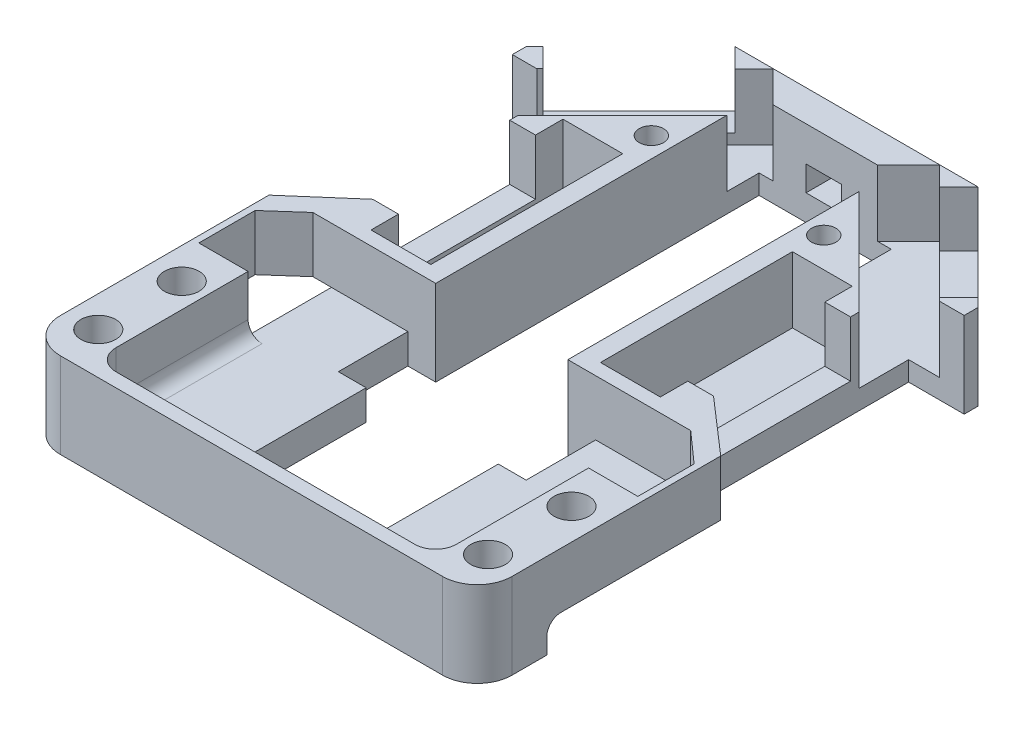
from build123d import *

# Parameters (mm, degrees)
SKETCH1_W               = 70
SKETCH1_H               = 85
BOSS_EXTRUDE1_DEPTH     = 2.8
SKETCH2_W               = 10.5
SKETCH2_H               = 60
CUT_EXTRUDE1_DEPTH      = 10
SKETCH3_W               = 2.519429159
SKETCH3_H               = 8
CUT_EXTRUDE2_DEPTH      = 10
CUT_EXTRUDE3_DEPTH      = 10
BOSS_EXTRUDE2_OUTLINE_W = 8.6
BOSS_EXTRUDE2_OUTLINE_H = 27.6
BOSS_EXTRUDE2_DEPTH     = 1.5
BOSS_EXTRUDE3_DEPTH     = 8
BOSS_EXTRUDE4_DEPTH     = 8
CUT_EXTRUDE5_DEPTH      = 8
SKETCH14_W              = 64.961141682
SKETCH14_H              = 2
BOSS_EXTRUDE5_DEPTH     = 12.3
FILLET1_R               = 5
SKETCH15_W              = 4
SKETCH15_H              = 10
CUT_EXTRUDE8_DEPTH      = 12.7
SKETCH16_R              = 1.75
CUT_EXTRUDE9_DEPTH      = 12.7
FILLET3_R               = 2
FILLET4_R               = 2
FILLET5_R               = 3
FILLET6_R               = 2
SKETCH17_R              = 2.5
CUT_EXTRUDE10_DEPTH     = 8
SKETCH18_W              = 19
SKETCH18_H              = 7
CUT_EXTRUDE11_DEPTH     = 57.451881976
SKETCH19_W              = 5.1
SKETCH19_H              = 3.6
CUT_EXTRUDE12_DEPTH     = 10


# Read off the part's stored shape, not the designer's step: Boss-Extrude2
with BuildPart() as part:
    # Sketch1 → Boss-Extrude1 (new body)
    with BuildSketch(Plane(origin=(0, 0, 0), x_dir=(1, 0, 0), z_dir=(0, 1, 0))):
        Rectangle(SKETCH1_W, SKETCH1_H)
    extrude(amount=BOSS_EXTRUDE1_DEPTH)

    # Sketch2 → Cut-Extrude1 (cut)
    with BuildSketch(Plane(origin=(0, 0, 0), x_dir=(-1, 0, 0), z_dir=(0, -1, 0))):
        with Locations((-29.75, -4.5)):
            Rectangle(SKETCH2_W, SKETCH2_H)
        with Locations((29.75, -4.5)):
            Rectangle(SKETCH2_W, SKETCH2_H)
    extrude(amount=-CUT_EXTRUDE1_DEPTH, mode=Mode.SUBTRACT)

    # Sketch3 → Cut-Extrude2 (cut)
    with BuildSketch(Plane(origin=(0, 2.8, 0), x_dir=(1, 0, 0), z_dir=(0, 1, 0))):
        Polygon((17.462549034, 42.5), (35, 42.5), (35, 25.5), (32.484854108, 25.5), (32.484996169, 27.489999862), align=None)
        with Locations((33.740285421, -38.5)):
            Rectangle(SKETCH3_W, SKETCH3_H)
        with Locations((-33.740285421, -38.5)):
            Rectangle(SKETCH3_W, SKETCH3_H)
        Polygon((-32.484996169, 27.489999862), (-17.462549034, 42.5), (-35, 42.5), (-35, 25.5), (-32.484854108, 25.5), align=None)
    extrude(amount=-CUT_EXTRUDE2_DEPTH, mode=Mode.SUBTRACT)

    # Sketch5 → Cut-Extrude3 (cut)
    with BuildSketch(Plane(origin=(0, 2.8, 0), x_dir=(1, 0, 0), z_dir=(0, 1, 0))):
        Polygon((-9.5, -42.5), (9.5, -42.5), (9.5, 31), (5.25, 31), (5.25, 38), (-5.25, 38), (-5.25, 31), (-9.5, 31), align=None)
    extrude(amount=-CUT_EXTRUDE3_DEPTH, mode=Mode.SUBTRACT)

    # Boss-Extrude2 outline → Boss-Extrude2 (add)
    with BuildSketch(Plane(origin=(0, 2.8, 0), x_dir=(1, 0, 0), z_dir=(0, 1, 0))):
        Polygon((-32.480570841, -42.5), (-9.5, -42.5), (-9.5, 31), (-5.25, 31), (-5.25, 38), (5.25, 38), (5.25, 31), (9.5, 31), (9.5, -42.5), (32.480570841, -42.5), (32.480570841, -34.5), (24.5, -34.5), (24.5, 18.363483562), (6.1866146, 36.661695224), (11.982486603, 42.462373437), (28.958926038, 25.5), (32.484854108, 25.5), (32.484996169, 27.489999862), (17.462549034, 42.5), (-17.462549034, 42.5), (-32.484996169, 27.489999862), (-32.484854108, 25.5), (-28.958926038, 25.5), (-11.982486603, 42.462373437), (-6.1866146, 36.661695224), (-24.5, 18.363483562), (-24.5, -34.5), (-32.480570841, -34.5), align=None)
        with Locations((-16.5, 7.293849796)):
            Rectangle(BOSS_EXTRUDE2_OUTLINE_W, BOSS_EXTRUDE2_OUTLINE_H, mode=Mode.SUBTRACT)
        with Locations((16.5, 7.293849796)):
            Rectangle(BOSS_EXTRUDE2_OUTLINE_W, BOSS_EXTRUDE2_OUTLINE_H, mode=Mode.SUBTRACT)
    extrude(amount=BOSS_EXTRUDE2_DEPTH)

    # Sketch9 → Boss-Extrude3 (add)
    with BuildSketch(Plane(origin=(0, 4.3, 0), x_dir=(1, 0, 0), z_dir=(0, 1, 0))):
        Polygon((-24.5, -34.5), (-32.480570841, -34.5), (-32.480570841, -42.5), (-9.5, -42.5), (-9.5, 31), (-5.25, 31), (-5.25, 38), (0, 38), (5.25, 38), (5.25, 31), (9.5, 31), (9.5, -42.5), (32.480570841, -42.5), (32.480570841, -34.5), (24.5, -34.5), (24.5, -2.556150204), (20.8, -2.556150204), (20.8, -6.506150204), (12.2, -6.506150204), (12.2, 21.093849796), (20.8, 21.093849796), (20.8, 17.143849796), (24.5, 17.143849796), (24.5, 18.363483562), (6.1866146, 36.661695224), (11.982486603, 42.462373437), (14.705975764, 39.74114085), (17.462549034, 42.5), (-17.462549034, 42.5), (-14.705975764, 39.74114085), (-11.982486603, 42.462373437), (-6.1866146, 36.661695224), (-24.5, 18.363483562), (-24.5, 17.143849796), (-20.8, 17.143849796), (-20.8, 21.093849796), (-12.2, 21.093849796), (-12.2, -6.506150204), (-20.8, -6.506150204), (-20.8, -2.556150204), (-24.5, -2.556150204), align=None)
        Polygon((-31.256844783, 28.717133652), (-32.484996169, 27.489999862), (-32.484854108, 25.5), (-28.958926038, 25.5), (-28.500271514, 25.958274502), align=None)
        Polygon((32.484996169, 27.489999862), (31.256844783, 28.717133652), (28.500271514, 25.958274502), (28.958926038, 25.5), (32.484854108, 25.5), align=None)
    extrude(amount=BOSS_EXTRUDE3_DEPTH)

    # Sketch10 → Boss-Extrude4 (add)
    with BuildSketch(Plane(origin=(0, 12.3, 0), x_dir=(1, 0, 0), z_dir=(0, 1, 0))):
        Polygon((-32.480570841, -34.5), (-24.5, -34.5), (-24.5, -2.556150204), (-32.480570841, -9.5), align=None)
        Polygon((32.480570841, -34.5), (24.5, -34.5), (24.5, -9.5), (24.5, -2.556150204), (32.480570841, -9.5), align=None)
    extrude(amount=-BOSS_EXTRUDE4_DEPTH)

    # Sketch11 → Cut-Extrude5 (cut)
    with BuildSketch(Plane(origin=(0, 12.3, 0), x_dir=(1, 0, 0), z_dir=(0, 1, 0))):
        Polygon((-24.480570841, -42.5), (-24.480570841, -20.499611406), (-31.560570841, -20.499611406), (-31.560570841, -12.405434935), (-27.162134436, -8.5), (-9.5, -8.5), (-9.5, -12.405776235), (-9.5, -42.5), align=None)
        Polygon((9.5, -42.5), (24.480570841, -42.5), (24.480570841, -20.499611406), (31.560570841, -20.499611406), (31.560570841, -12.405434935), (27.162134436, -8.5), (9.5, -8.5), (9.5, -12.405776235), align=None)
    extrude(amount=-CUT_EXTRUDE5_DEPTH, mode=Mode.SUBTRACT)

    # Sketch14 → Boss-Extrude5 (add)
    with BuildSketch(Plane(origin=(0, 0, 0), x_dir=(-1, 0, 0), z_dir=(0, -1, 0))):
        with Locations((0, -43.5)):
            Rectangle(SKETCH14_W, SKETCH14_H)
    extrude(amount=-BOSS_EXTRUDE5_DEPTH)

    # Fillet1
    fillet1_edges = [part.edges().sort_by_distance(p)[0] for p in [
        (32.480570841, 6.15, 44.5),
        (-32.480570841, 6.15, 44.5),
    ]]
    fillet(fillet1_edges, radius=FILLET1_R)

    # Sketch15 → Cut-Extrude8 (cut)
    with BuildSketch(Plane(origin=(0, 4.3, 0), x_dir=(1, 0, 0), z_dir=(0, 1, 0))):
        with Locations((-11.5, -13.5)):
            Rectangle(SKETCH15_W, SKETCH15_H)
        with Locations((11.5, -13.5)):
            Rectangle(SKETCH15_W, SKETCH15_H)
    extrude(amount=-CUT_EXTRUDE8_DEPTH, mode=Mode.SUBTRACT)

    # Sketch16 → Cut-Extrude9 (cut)
    with BuildSketch(Plane(origin=(0, 0, 0), x_dir=(-1, 0, 0), z_dir=(0, -1, 0))):
        with Locations(Location((-17.000570841, -39, 0), (0, 0, 90))):
            Circle(SKETCH16_R)
        with Locations(Location((-12.394846918, 25.4, 0), (0, 0, 90))):
            Circle(SKETCH16_R)
        with Locations(Location((12.394846918, 25.4, 0), (0, 0, 270))):
            Circle(SKETCH16_R)
        with Locations(Location((17.000570841, -39, 0), (0, 0, 90))):
            Circle(SKETCH16_R)
    extrude(amount=-CUT_EXTRUDE9_DEPTH, mode=Mode.SUBTRACT)

    # Fillet3
    fillet3_edges = [part.edges().sort_by_distance(p)[0] for p in [
        (-24.5, 4.3, 27.499805703),
        (24.5, 4.3, 27.499805703),
    ]]
    fillet(fillet3_edges, radius=FILLET3_R)

    # Fillet4
    fillet4_edges = [part.edges().sort_by_distance(p)[0] for p in [
        (-29.490285421, 4.3, 34.5),
        (24.5, 1.15, 34.5),
        (29.490285421, 4.3, 34.5),
        (25.085786438, 3.714213562, 34.5),
        (-24.5, 1.15, 34.5),
        (-25.085786438, 3.714213562, 34.5),
    ]]
    fillet(fillet4_edges, radius=FILLET4_R)

    # Fillet5
    fillet5_edges = [part.edges().sort_by_distance(p)[0] for p in [
        (-24.480570841, 8.3, 42.5),
        (24.480570841, 8.3, 42.5),
    ]]
    fillet(fillet5_edges, radius=FILLET5_R)

    # Fillet6
    fillet6_edges = [part.edges().sort_by_distance(p)[0] for p in [
        (-24.480570841, 4.3, 29.999805703),
        (15.490285421, 4.3, 42.5),
        (-15.490285421, 4.3, 42.5),
        (-23.601891185, 4.3, 41.621320344),
        (24.480570841, 4.3, 29.999805703),
        (23.601891185, 4.3, 41.621320344),
    ]]
    fillet(fillet6_edges, radius=FILLET6_R)

    # Sketch17 → Cut-Extrude10 (cut)
    with BuildSketch(Plane(origin=(0, 12.3, 0), x_dir=(1, 0, 0), z_dir=(0, 1, 0))):
        with Locations(Location((-28.020570841, -26.499611406, 0), (0, 0, 270))):
            Circle(SKETCH17_R)
        with Locations(Location((-28.020570841, -38.5, 0), (0, 0, 270))):
            Circle(SKETCH17_R)
        with Locations(Location((28.020570841, -38.5, 0), (0, 0, 90))):
            Circle(SKETCH17_R)
        with Locations(Location((28.020570841, -26.499611406, 0), (0, 0, 232.538489895))):
            Circle(SKETCH17_R)
    extrude(amount=-CUT_EXTRUDE10_DEPTH, mode=Mode.SUBTRACT)

    # Sketch18 → Cut-Extrude11 (cut, through all)
    with BuildSketch(Plane(origin=(0, 12.3, 0), x_dir=(1, 0, 0), z_dir=(0, 1, 0))):
        with Locations((0, 34.5)):
            Rectangle(SKETCH18_W, SKETCH18_H)
    extrude(amount=-CUT_EXTRUDE11_DEPTH, mode=Mode.SUBTRACT)

    # Sketch19 → Cut-Extrude12 (cut)
    with BuildSketch(Plane(origin=(0, 0, -42.5), x_dir=(-1, 0, 0), z_dir=(0, 0, -1))):
        with Locations((0.200058215, 5.5)):
            Rectangle(SKETCH19_W, SKETCH19_H)
    extrude(amount=-CUT_EXTRUDE12_DEPTH, mode=Mode.SUBTRACT)


solid = part.part
